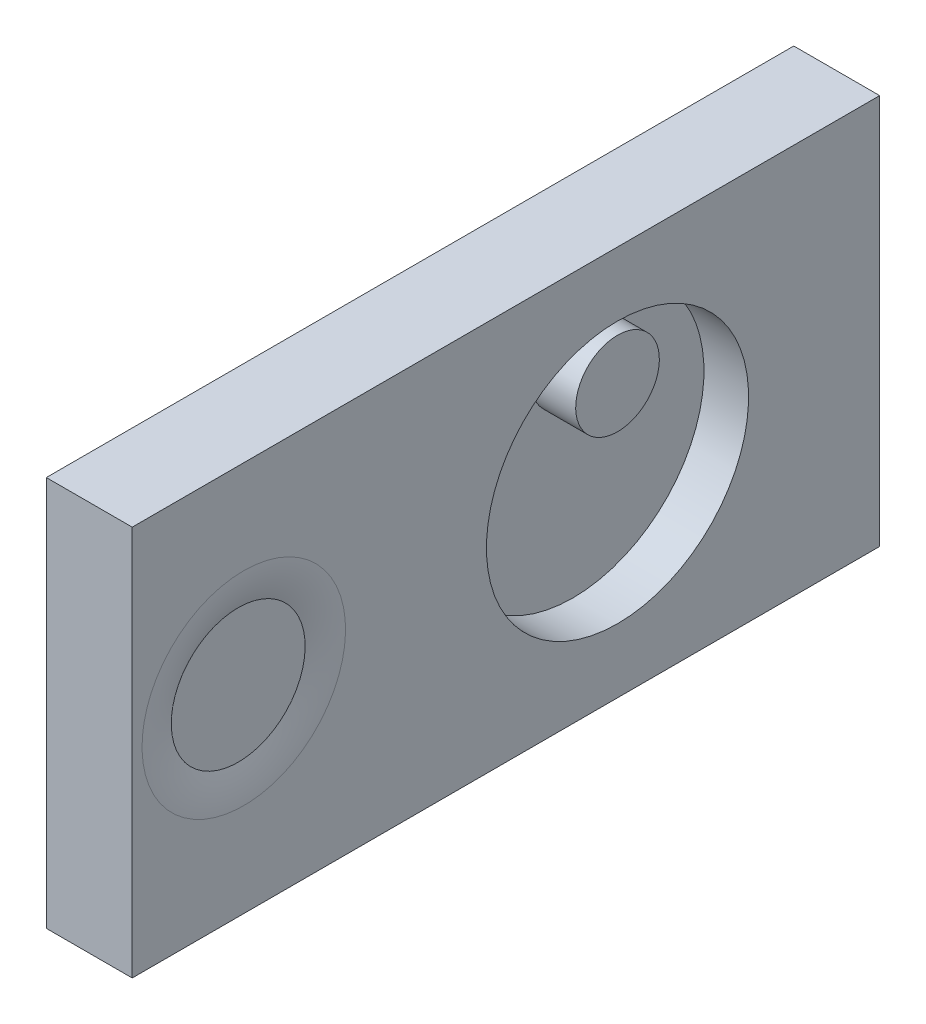
from build123d import *

# Parameters (mm, degrees)
SKETCH1_W           = 7.7
SKETCH1_H           = 35
BOSS_EXTRUDE1_DEPTH = 47
SKETCH2_R           = 11.75
SKETCH2_R_2         = 3.75
CUT_EXTRUDE1_DEPTH  = 4
SKETCH3_W           = 7.7
SKETCH3_H           = 35
BOSS_EXTRUDE2_DEPTH = 20
SKETCH4_R           = 6
CUT_EXTRUDE2_DEPTH  = 0.5
FILLET1_R           = 10


with BuildPart() as part:
    # Sketch1 → Boss-Extrude1 (new body)
    with BuildSketch(Plane.XY):
        with Locations((3.85, 17.5)):
            Rectangle(SKETCH1_W, SKETCH1_H)
    extrude(amount=-BOSS_EXTRUDE1_DEPTH)

    # Sketch2 → Cut-Extrude1 (cut)
    with BuildSketch(Plane(origin=(7.7, 0, 0), x_dir=(0, 0, -1), z_dir=(1, 0, 0))):
        with Locations(Location((23.5, 17.5, 0), (0, 0, 90))):
            Circle(SKETCH2_R)
        with Locations(Location((23.5, 24.4, 0), (0, 0, 90))):
            Circle(SKETCH2_R_2, mode=Mode.SUBTRACT)
    extrude(amount=-CUT_EXTRUDE1_DEPTH, mode=Mode.SUBTRACT)

    # Sketch3 → Boss-Extrude2 (add)
    with BuildSketch(Plane.XY):
        with Locations((3.85, 17.5)):
            Rectangle(SKETCH3_W, SKETCH3_H)
    extrude(amount=BOSS_EXTRUDE2_DEPTH)

    # Sketch4 → Cut-Extrude2 (cut)
    with BuildSketch(Plane(origin=(7.7, 0, 0), x_dir=(0, 0, -1), z_dir=(1, 0, 0))):
        with Locations(Location((-10, 17.5, 0), (0, 0, 90))):
            Circle(SKETCH4_R)
    extrude(amount=-CUT_EXTRUDE2_DEPTH, mode=Mode.SUBTRACT)

    # Fillet1
    # the kernel refuses this fillet: 10 mm, written as the material it takes off along each edge
    with BuildSketch(Plane(origin=(7.7, 17.5, 10), x_dir=(0, 1, 0), z_dir=(0, 0, -1))) as fillet1_piece_1:
        with BuildLine():
            CenterArc((9.122498999, -10), FILLET1_R, 90, 18.194872339)
            Line((6, -0.5), (5.93755002, -0.31))
            ThreePointArc((5.93755002, -0.31), (5.8, -0.25), (5.8, 0))
            Line((5.8, 0), (6, 0.2))
            Line((6, 0.2), (9.122498999, 0.2))
            Line((9.122498999, 0.2), (9.122498999, 0))
        make_face()
    revolve(axis=Axis((7.7, 17.5, 10), (1, 0, 0)), mode=Mode.SUBTRACT)


solid = part.part
